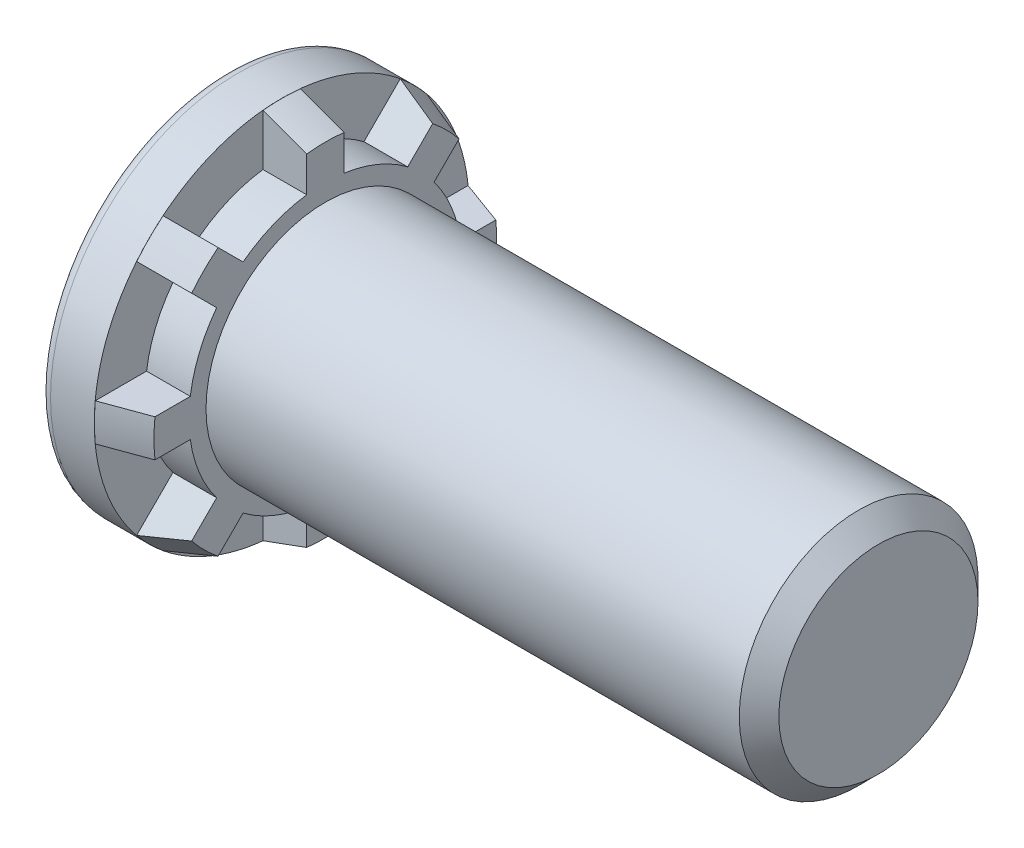
from build123d import *

# Parameters (mm, degrees)
RIBCUT_START     = -1.832
RIBCUT_DEPTH     = 1.832
RIBCUTSPAT_COUNT = 8
RIBCUTSPAT_ANGLE = 315


with BuildPart() as part:
    # BodySke → BaseBody (revolve)
    with BuildSketch(Plane.XY):
        with BuildLine():
            Line((-2.29, 7.392), (-2.29, 0))
            Line((-2.29, 0), (25, 0))
            Line((25, 0), (25, 4.172))
            Line((25, 4.172), (24.172, 5))
            Line((24.172, 5), (1.832, 5))
            Line((1.832, 5), (1.832, 7.181591015))
            Line((1.832, 7.181591015), (0.00254, 7.84746))
            Line((0.00254, 7.84746), (0, 7.84746))
            Line((0, 7.84746), (0, 7.85))
            Line((0, 7.85), (-1.832, 7.85))
            ThreePointArc((-1.832, 7.85), (-2.155854906, 7.715854906), (-2.29, 7.392))
        make_face()
    revolve(axis=Axis((0, 0, 0), (1, 0, 0)))

    # RibCutSke → RibCut (cut)
    with BuildSketch(Plane(origin=(1.832, 1.794401132, -0.090952894), x_dir=(0, 0, -1), z_dir=(1, 0, 0)).offset(RIBCUT_START)):
        with BuildLine():
            Line((0.691219431, 3.864296837), (0.691219431, 6.016533924))
            ThreePointArc((0.691219431, 6.016533924), (2.91311205, 5.458053198), (4.879132896, 4.281843369))
            Line((4.879132896, 4.281843369), (3.357271457, 2.759981929))
            ThreePointArc((3.357271457, 2.759981929), (2.095126213, 3.483260697), (0.691219431, 3.864296837))
        make_face()
    ribcut = extrude(amount=RIBCUT_DEPTH, mode=Mode.SUBTRACT)

    # RibCutsPat: RibCut ×8 about axis
    ribcutspat_axis = Axis((0, 0, 0), (1, 0, 0))
    for i in range(1, RIBCUTSPAT_COUNT):
        add(ribcut.rotate(ribcutspat_axis, i * RIBCUTSPAT_ANGLE / (RIBCUTSPAT_COUNT - 1)), mode=Mode.SUBTRACT)


solid = part.part
